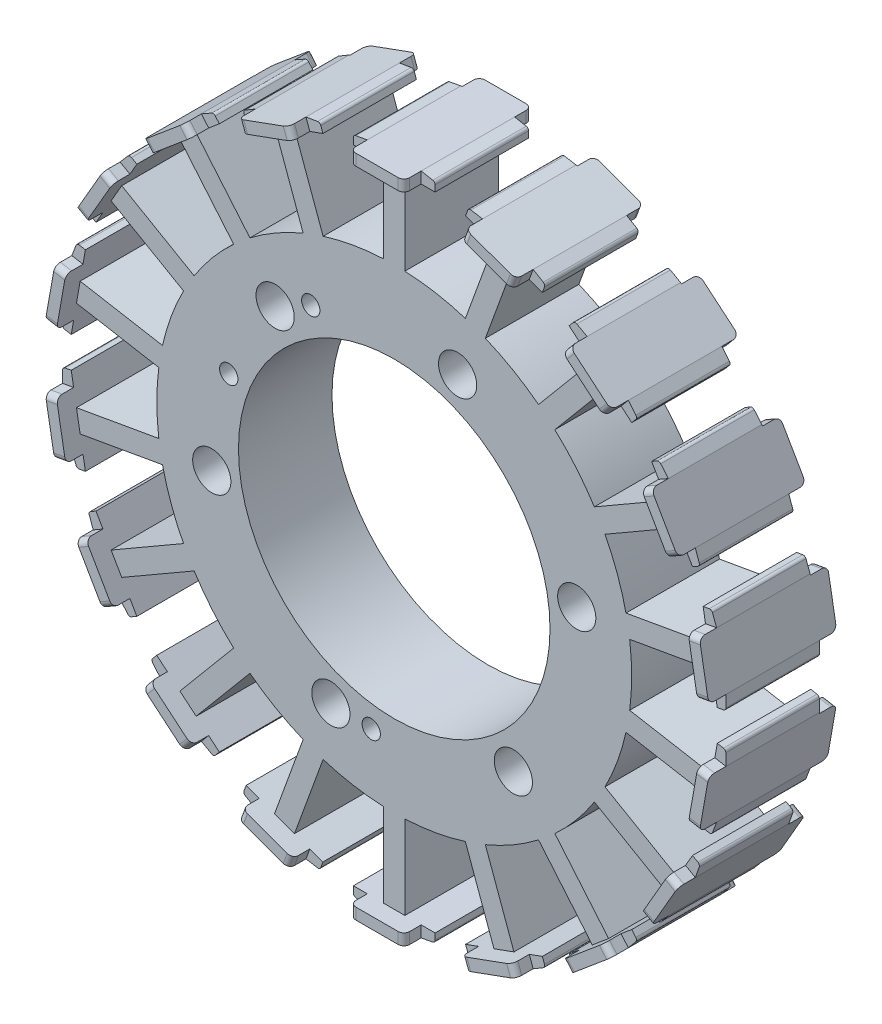
from build123d import *

# Parameters (mm, degrees)
SKETCH1_R           = 26.9
BOSS_EXTRUDE1_DEPTH = 16.148
SKETCH3_R           = 3.3
CUT_EXTRUDE1_DEPTH  = 17
SKETCH4_W           = 9.09525
SKETCH4_H           = 1.948
BOSS_EXTRUDE3_DEPTH = 2.976
SKETCH5_W           = 9.3
SKETCH5_H           = 1.948
BOSS_EXTRUDE4_DEPTH = 2.976
FILLET6_R           = 1
FILLET7_R           = 1
FILLET8_R           = 1
FILLET9_R           = 1
SKETCH6_R           = 1.58
CUT_EXTRUDE2_DEPTH  = 84.283946065
SKETCH7_R           = 1.58
CUT_EXTRUDE3_DEPTH  = 84.283946065
FILLET10_R          = 0.5
CIRPATTERN1_DEPTH   = 16.148
FILLET11_R          = 0.5
CIRPATTERN2_DEPTH   = 16.148


# Read off the part's stored shape, not the designer's step: CirPattern1, CirPattern2
with BuildPart() as part:
    # Sketch1 → Boss-Extrude1 (new body)
    # profile 1 of 19: a face of its own
    with BuildSketch(Plane.XY):
        with BuildLine():
            ThreePointArc((15.73264799, 37.861375929), (14.022825876, 38.527397452), (12.284915764, 39.116247835))
            ThreePointArc((12.284915764, 39.116247835), (7.119575284, 40.377117873), (1.8345, 40.958938094))
            ThreePointArc((1.8345, 40.958938094), (1.237294731, 40.981326257), (0.639826578, 40.995007281))
            Line((0.639826578, 40.995007281), (0.638750622, 40.99502406))
            ThreePointArc((0.638750622, 40.99502406), (-0.598146882, 40.995636601), (-1.8345, 40.958938094))
            ThreePointArc((-1.8345, 40.958938094), (-7.119575284, 40.377117874), (-12.284915764, 39.116247835))
            ThreePointArc((-12.284915764, 39.116247835), (-14.022825876, 38.527397452), (-15.73264799, 37.861375929))
            ThreePointArc((-15.73264799, 37.861375929), (-20.5, 35.507041555), (-24.922589381, 32.555560793))
            ThreePointArc((-24.922589381, 32.555560793), (-26.354291997, 31.407822168), (-27.733206443, 30.197173053))
            ThreePointArc((-27.733206443, 30.197173053), (-31.407822168, 26.354291997), (-34.554230901, 22.06819265))
            ThreePointArc((-34.554230901, 22.06819265), (-35.507041555, 20.5), (-36.388730901, 18.890745444))
            ThreePointArc((-36.388730901, 18.890745444), (-38.527397452, 14.022825876), (-40.018122208, 8.919074782))
            ThreePointArc((-40.018122208, 8.919074782), (-40.377117873, 7.119575284), (-40.655237372, 5.305815136))
            ThreePointArc((-40.655237372, 5.305815136), (-41, 0), (-40.655237372, -5.305815136))
            ThreePointArc((-40.655237372, -5.305815136), (-40.377117874, -7.119575284), (-40.018122208, -8.919074782))
            ThreePointArc((-40.018122208, -8.919074782), (-38.527397452, -14.022825876), (-36.388730901, -18.890745443))
            ThreePointArc((-36.388730901, -18.890745443), (-35.507041555, -20.5), (-34.554230901, -22.06819265))
            ThreePointArc((-34.554230901, -22.06819265), (-31.407822168, -26.354291997), (-27.733206443, -30.197173053))
            ThreePointArc((-27.733206443, -30.197173053), (-26.354291997, -31.407822168), (-24.922589382, -32.555560793))
            ThreePointArc((-24.922589382, -32.555560793), (-20.5, -35.507041555), (-15.73264799, -37.861375929))
            ThreePointArc((-15.73264799, -37.861375929), (-14.022825876, -38.527397452), (-12.284915764, -39.116247835))
            ThreePointArc((-12.284915764, -39.116247835), (-7.119575284, -40.377117873), (-1.8345, -40.958938094))
            ThreePointArc((-1.8345, -40.958938094), (0, -41), (1.8345, -40.958938094))
            ThreePointArc((1.8345, -40.958938094), (7.119575284, -40.377117874), (12.284915764, -39.116247835))
            ThreePointArc((12.284915764, -39.116247835), (14.022825876, -38.527397452), (15.73264799, -37.861375929))
            ThreePointArc((15.73264799, -37.861375929), (20.5, -35.507041555), (24.922589381, -32.555560793))
            ThreePointArc((24.922589381, -32.555560793), (26.354291997, -31.407822168), (27.733206443, -30.197173053))
            ThreePointArc((27.733206443, -30.197173053), (31.407822168, -26.354291997), (34.554230901, -22.06819265))
            ThreePointArc((34.554230901, -22.06819265), (35.507041555, -20.5), (36.388730901, -18.890745444))
            ThreePointArc((36.388730901, -18.890745444), (38.527397452, -14.022825876), (40.018122208, -8.919074782))
            ThreePointArc((40.018122208, -8.919074782), (40.377117873, -7.119575284), (40.655237372, -5.305815136))
            ThreePointArc((40.655237372, -5.305815136), (40.913718556, -2.658502188), (41, 0))
            ThreePointArc((41, 0), (40.913718556, 2.658502188), (40.655237372, 5.305815136))
            ThreePointArc((40.655237372, 5.305815136), (40.377117874, 7.119575284), (40.018122208, 8.919074782))
            ThreePointArc((40.018122208, 8.919074782), (38.527397452, 14.022825876), (36.388730901, 18.890745443))
            ThreePointArc((36.388730901, 18.890745443), (35.507041555, 20.5), (34.554230901, 22.06819265))
            ThreePointArc((34.554230901, 22.06819265), (31.407822168, 26.354291997), (27.733206443, 30.197173053))
            ThreePointArc((27.733206443, 30.197173053), (26.354291997, 31.407822168), (24.922589382, 32.555560793))
            ThreePointArc((24.922589382, 32.555560793), (20.5, 35.507041555), (15.73264799, 37.861375929))
        make_face()
        Circle(SKETCH1_R, mode=Mode.SUBTRACT)
    # profile 2 of 19: a face of its own
    with BuildSketch(Plane.XY):
        with BuildLine():
            Line((12.317765655, 54.473146842), (17.224370674, 52.687288664))
            Line((17.224370674, 52.687288664), (12.284915764, 39.116247835))
            ThreePointArc((12.284915764, 39.116247835), (14.022825876, 38.527397452), (15.73264799, 37.861375929))
            Line((15.73264799, 37.861375929), (20.6721029, 51.432416758))
            Line((20.6721029, 51.432416758), (25.578707919, 49.64655858))
            Line((25.578707919, 49.64655858), (26.091738134, 51.056097511))
            Line((26.091738134, 51.056097511), (23.984062713, 52.29998027))
            Line((23.984062713, 52.29998027), (15.24492134, 55.480767603))
            Line((15.24492134, 55.480767603), (12.83079587, 55.882685774))
            Line((12.83079587, 55.882685774), (12.317765655, 54.473146842))
        make_face()
    # profile 3 of 19: a face of its own
    with BuildSketch(Plane.XY):
        with BuildLine():
            ThreePointArc((0.639826578, 40.995007281), (1.237294731, 40.981326257), (1.8345, 40.958938094))
            Line((1.8345, 40.958938094), (1.8345, 55.400938094))
            Line((1.8345, 55.400938094), (7.056, 55.400938094))
            Line((7.056, 55.400938094), (7.056, 56.900938094))
            Line((7.056, 56.900938094), (4.65, 57.348938094))
            Line((4.65, 57.348938094), (-4.65, 57.348938094))
            Line((-4.65, 57.348938094), (-7.056, 56.900938094))
            Line((-7.056, 56.900938094), (-7.056, 55.400938094))
            Line((-7.056, 55.400938094), (-1.8345, 55.400938094))
            Line((-1.8345, 55.400938094), (-1.8345, 40.958938094))
            ThreePointArc((-1.8345, 40.958938094), (-0.598146882, 40.995636601), (0.638750622, 40.99502406))
            Line((0.638750622, 40.99502406), (0.639826578, 40.995007281))
        make_face()
    # profile 4 of 19: a face of its own
    with BuildSketch(Plane.XY):
        with BuildLine():
            ThreePointArc((-15.73264799, 37.861375929), (-14.022825876, 38.527397452), (-12.284915764, 39.116247835))
            Line((-12.284915764, 39.116247835), (-17.224370674, 52.687288664))
            Line((-17.224370674, 52.687288664), (-12.317765655, 54.473146842))
            Line((-12.317765655, 54.473146842), (-12.83079587, 55.882685774))
            Line((-12.83079587, 55.882685774), (-15.24492134, 55.480767603))
            Line((-15.24492134, 55.480767603), (-23.984062713, 52.29998027))
            Line((-23.984062713, 52.29998027), (-26.091738134, 51.056097511))
            Line((-26.091738134, 51.056097511), (-25.578707919, 49.64655858))
            Line((-25.578707919, 49.64655858), (-20.6721029, 51.432416758))
            Line((-20.6721029, 51.432416758), (-15.73264799, 37.861375929))
        make_face()
    # profile 5 of 19: a face of its own
    with BuildSketch(Plane.XY):
        with BuildLine():
            ThreePointArc((-27.733206443, 30.197173053), (-26.354291997, 31.407822168), (-24.922589381, 32.555560793))
            Line((-24.922589381, 32.555560793), (-34.205728041, 43.61877464))
            Line((-34.205728041, 43.61877464), (-30.205826981, 46.975090144))
            Line((-30.205826981, 46.975090144), (-31.170008395, 48.124156809))
            Line((-31.170008395, 48.124156809), (-33.301080175, 46.92079773))
            Line((-33.301080175, 46.92079773), (-40.425293496, 40.94287296))
            Line((-40.425293496, 40.94287296), (-41.980427577, 39.053138061))
            Line((-41.980427577, 39.053138061), (-41.016246162, 37.904071396))
            Line((-41.016246162, 37.904071396), (-37.016345102, 41.2603869))
            Line((-37.016345102, 41.2603869), (-27.733206443, 30.197173053))
        make_face()
    # profile 6 of 19: a face of its own
    with BuildSketch(Plane.XY):
        with BuildLine():
            ThreePointArc((-36.388730901, 18.890745444), (-35.507041555, 20.5), (-34.554230901, 22.06819265))
            Line((-34.554230901, 22.06819265), (-47.061369782, 29.28919265))
            Line((-47.061369782, 29.28919265), (-44.450619782, 33.811144296))
            Line((-44.450619782, 33.811144296), (-45.749657888, 34.561144296))
            Line((-45.749657888, 34.561144296), (-47.340637269, 32.701487174))
            Line((-47.340637269, 32.701487174), (-51.990637269, 24.647450919))
            Line((-51.990637269, 24.647450919), (-52.805657888, 22.339793798))
            Line((-52.805657888, 22.339793798), (-51.506619782, 21.589793798))
            Line((-51.506619782, 21.589793798), (-48.895869782, 26.111745444))
            Line((-48.895869782, 26.111745444), (-36.388730901, 18.890745444))
        make_face()
    # profile 7 of 19: a face of its own
    with BuildSketch(Plane.XY):
        with BuildLine():
            ThreePointArc((-40.655237372, 5.305815136), (-40.377117873, 7.119575284), (-40.018122208, 8.919074782))
            Line((-40.018122208, 8.919074782), (-54.240715777, 11.426901764))
            Line((-54.240715777, 11.426901764), (-53.334011817, 16.569075446))
            Line((-53.334011817, 16.569075446), (-54.811223447, 16.829547713))
            Line((-54.811223447, 16.829547713), (-55.670214835, 14.537894643))
            Line((-55.670214835, 14.537894643), (-57.285142888, 5.37918254))
            Line((-57.285142888, 5.37918254), (-57.26174653, 2.931940702))
            Line((-57.26174653, 2.931940702), (-55.7845349, 2.671468436))
            Line((-55.7845349, 2.671468436), (-54.877830941, 7.813642118))
            Line((-54.877830941, 7.813642118), (-40.655237372, 5.305815136))
        make_face()
    # profile 8 of 19: a face of its own
    with BuildSketch(Plane.XY):
        with BuildLine():
            ThreePointArc((-40.018122208, -8.919074782), (-40.377117874, -7.119575284), (-40.655237372, -5.305815136))
            Line((-40.655237372, -5.305815136), (-54.877830941, -7.813642118))
            Line((-54.877830941, -7.813642118), (-55.7845349, -2.671468436))
            Line((-55.7845349, -2.671468436), (-57.26174653, -2.931940702))
            Line((-57.26174653, -2.931940702), (-57.285142888, -5.37918254))
            Line((-57.285142888, -5.37918254), (-55.670214835, -14.537894643))
            Line((-55.670214835, -14.537894643), (-54.811223447, -16.829547713))
            Line((-54.811223447, -16.829547713), (-53.334011817, -16.569075446))
            Line((-53.334011817, -16.569075446), (-54.240715777, -11.426901764))
            Line((-54.240715777, -11.426901764), (-40.018122208, -8.919074782))
        make_face()
    # profile 9 of 19: a face of its own
    with BuildSketch(Plane.XY):
        with BuildLine():
            ThreePointArc((-34.554230901, -22.06819265), (-35.507041555, -20.5), (-36.388730901, -18.890745443))
            Line((-36.388730901, -18.890745443), (-48.895869783, -26.111745443))
            Line((-48.895869783, -26.111745443), (-51.506619782, -21.589793798))
            Line((-51.506619782, -21.589793798), (-52.805657888, -22.339793798))
            Line((-52.805657888, -22.339793798), (-51.990637269, -24.647450919))
            Line((-51.990637269, -24.647450919), (-47.340637269, -32.701487174))
            Line((-47.340637269, -32.701487174), (-45.749657888, -34.561144296))
            Line((-45.749657888, -34.561144296), (-44.450619782, -33.811144296))
            Line((-44.450619782, -33.811144296), (-47.061369782, -29.28919265))
            Line((-47.061369782, -29.28919265), (-34.554230901, -22.06819265))
        make_face()
    # profile 10 of 19: a face of its own
    with BuildSketch(Plane.XY):
        with BuildLine():
            ThreePointArc((-24.922589382, -32.555560793), (-26.354291997, -31.407822168), (-27.733206443, -30.197173053))
            Line((-27.733206443, -30.197173053), (-37.016345103, -41.2603869))
            Line((-37.016345103, -41.2603869), (-41.016246162, -37.904071396))
            Line((-41.016246162, -37.904071396), (-41.980427577, -39.053138061))
            Line((-41.980427577, -39.053138061), (-40.425293496, -40.94287296))
            Line((-40.425293496, -40.94287296), (-33.301080175, -46.92079773))
            Line((-33.301080175, -46.92079773), (-31.170008395, -48.124156809))
            Line((-31.170008395, -48.124156809), (-30.205826981, -46.975090144))
            Line((-30.205826981, -46.975090144), (-34.205728041, -43.61877464))
            Line((-34.205728041, -43.61877464), (-24.922589382, -32.555560793))
        make_face()
    # profile 11 of 19: a face of its own
    with BuildSketch(Plane.XY):
        with BuildLine():
            Line((34.205728041, 43.61877464), (24.922589382, 32.555560793))
            ThreePointArc((24.922589382, 32.555560793), (26.354291997, 31.407822168), (27.733206443, 30.197173053))
            Line((27.733206443, 30.197173053), (37.016345103, 41.2603869))
            Line((37.016345103, 41.2603869), (41.016246162, 37.904071396))
            Line((41.016246162, 37.904071396), (41.980427577, 39.053138061))
            Line((41.980427577, 39.053138061), (40.425293496, 40.94287296))
            Line((40.425293496, 40.94287296), (33.301080175, 46.92079773))
            Line((33.301080175, 46.92079773), (31.170008395, 48.124156809))
            Line((31.170008395, 48.124156809), (30.205826981, 46.975090144))
            Line((30.205826981, 46.975090144), (34.205728041, 43.61877464))
        make_face()
    # profile 12 of 19: a face of its own
    with BuildSketch(Plane.XY):
        with BuildLine():
            Line((47.061369783, 29.28919265), (34.554230901, 22.06819265))
            ThreePointArc((34.554230901, 22.06819265), (35.507041555, 20.5), (36.388730901, 18.890745443))
            Line((36.388730901, 18.890745443), (48.895869783, 26.111745443))
            Line((48.895869783, 26.111745443), (51.506619783, 21.589793798))
            Line((51.506619783, 21.589793798), (52.805657888, 22.339793798))
            Line((52.805657888, 22.339793798), (51.990637269, 24.647450919))
            Line((51.990637269, 24.647450919), (47.340637269, 32.701487174))
            Line((47.340637269, 32.701487174), (45.749657888, 34.561144296))
            Line((45.749657888, 34.561144296), (44.450619783, 33.811144296))
            Line((44.450619783, 33.811144296), (47.061369783, 29.28919265))
        make_face()
    # profile 13 of 19: a face of its own
    with BuildSketch(Plane.XY):
        with BuildLine():
            Line((54.240715777, 11.426901764), (40.018122208, 8.919074782))
            ThreePointArc((40.018122208, 8.919074782), (40.377117874, 7.119575284), (40.655237372, 5.305815136))
            Line((40.655237372, 5.305815136), (54.877830941, 7.813642118))
            Line((54.877830941, 7.813642118), (55.7845349, 2.671468436))
            Line((55.7845349, 2.671468436), (57.26174653, 2.931940702))
            Line((57.26174653, 2.931940702), (57.285142888, 5.37918254))
            Line((57.285142888, 5.37918254), (55.670214835, 14.537894643))
            Line((55.670214835, 14.537894643), (54.811223447, 16.829547713))
            Line((54.811223447, 16.829547713), (53.334011817, 16.569075446))
            Line((53.334011817, 16.569075446), (54.240715777, 11.426901764))
        make_face()
    # profile 14 of 19: a face of its own
    with BuildSketch(Plane.XY):
        with BuildLine():
            Line((54.877830941, -7.813642118), (40.655237372, -5.305815136))
            ThreePointArc((40.655237372, -5.305815136), (40.377117873, -7.119575284), (40.018122208, -8.919074782))
            Line((40.018122208, -8.919074782), (54.240715777, -11.426901764))
            Line((54.240715777, -11.426901764), (53.334011817, -16.569075446))
            Line((53.334011817, -16.569075446), (54.811223447, -16.829547713))
            Line((54.811223447, -16.829547713), (55.670214835, -14.537894643))
            Line((55.670214835, -14.537894643), (57.285142888, -5.37918254))
            Line((57.285142888, -5.37918254), (57.26174653, -2.931940702))
            Line((57.26174653, -2.931940702), (55.7845349, -2.671468436))
            Line((55.7845349, -2.671468436), (54.877830941, -7.813642118))
        make_face()
    # profile 15 of 19: a face of its own
    with BuildSketch(Plane.XY):
        with BuildLine():
            Line((48.895869783, -26.111745444), (36.388730901, -18.890745444))
            ThreePointArc((36.388730901, -18.890745444), (35.507041555, -20.5), (34.554230901, -22.06819265))
            Line((34.554230901, -22.06819265), (47.061369782, -29.28919265))
            Line((47.061369782, -29.28919265), (44.450619782, -33.811144296))
            Line((44.450619782, -33.811144296), (45.749657888, -34.561144296))
            Line((45.749657888, -34.561144296), (47.340637269, -32.701487174))
            Line((47.340637269, -32.701487174), (51.990637269, -24.647450919))
            Line((51.990637269, -24.647450919), (52.805657888, -22.339793798))
            Line((52.805657888, -22.339793798), (51.506619783, -21.589793798))
            Line((51.506619783, -21.589793798), (48.895869783, -26.111745444))
        make_face()
    # profile 16 of 19: a face of its own
    with BuildSketch(Plane.XY):
        with BuildLine():
            Line((37.016345102, -41.2603869), (27.733206443, -30.197173053))
            ThreePointArc((27.733206443, -30.197173053), (26.354291997, -31.407822168), (24.922589381, -32.555560793))
            Line((24.922589381, -32.555560793), (34.205728041, -43.61877464))
            Line((34.205728041, -43.61877464), (30.205826981, -46.975090144))
            Line((30.205826981, -46.975090144), (31.170008395, -48.124156809))
            Line((31.170008395, -48.124156809), (33.301080175, -46.92079773))
            Line((33.301080175, -46.92079773), (40.425293496, -40.94287296))
            Line((40.425293496, -40.94287296), (41.980427577, -39.053138061))
            Line((41.980427577, -39.053138061), (41.016246162, -37.904071396))
            Line((41.016246162, -37.904071396), (37.016345102, -41.2603869))
        make_face()
    # profile 17 of 19: a face of its own
    with BuildSketch(Plane.XY):
        with BuildLine():
            Line((20.6721029, -51.432416758), (15.73264799, -37.861375929))
            ThreePointArc((15.73264799, -37.861375929), (14.022825876, -38.527397452), (12.284915764, -39.116247835))
            Line((12.284915764, -39.116247835), (17.224370674, -52.687288664))
            Line((17.224370674, -52.687288664), (12.317765655, -54.473146842))
            Line((12.317765655, -54.473146842), (12.83079587, -55.882685774))
            Line((12.83079587, -55.882685774), (15.24492134, -55.480767603))
            Line((15.24492134, -55.480767603), (23.984062713, -52.29998027))
            Line((23.984062713, -52.29998027), (26.091738134, -51.056097511))
            Line((26.091738134, -51.056097511), (25.578707919, -49.64655858))
            Line((25.578707919, -49.64655858), (20.6721029, -51.432416758))
        make_face()
    # profile 18 of 19: a face of its own
    with BuildSketch(Plane.XY):
        with BuildLine():
            Line((1.8345, -55.400938094), (1.8345, -40.958938094))
            ThreePointArc((1.8345, -40.958938094), (0, -41), (-1.8345, -40.958938094))
            Line((-1.8345, -40.958938094), (-1.8345, -55.400938094))
            Line((-1.8345, -55.400938094), (-7.056, -55.400938094))
            Line((-7.056, -55.400938094), (-7.056, -56.900938094))
            Line((-7.056, -56.900938094), (-4.65, -57.348938094))
            Line((-4.65, -57.348938094), (4.65, -57.348938094))
            Line((4.65, -57.348938094), (7.056, -56.900938094))
            Line((7.056, -56.900938094), (7.056, -55.400938094))
            Line((7.056, -55.400938094), (1.8345, -55.400938094))
        make_face()
    # profile 19 of 19: a face of its own
    with BuildSketch(Plane.XY):
        with BuildLine():
            Line((-17.224370674, -52.687288664), (-12.284915764, -39.116247835))
            ThreePointArc((-12.284915764, -39.116247835), (-14.022825876, -38.527397452), (-15.73264799, -37.861375929))
            Line((-15.73264799, -37.861375929), (-20.6721029, -51.432416758))
            Line((-20.6721029, -51.432416758), (-25.578707919, -49.64655858))
            Line((-25.578707919, -49.64655858), (-26.091738134, -51.056097511))
            Line((-26.091738134, -51.056097511), (-23.984062713, -52.29998027))
            Line((-23.984062713, -52.29998027), (-15.24492134, -55.480767603))
            Line((-15.24492134, -55.480767603), (-12.83079587, -55.882685774))
            Line((-12.83079587, -55.882685774), (-12.317765655, -54.473146842))
            Line((-12.317765655, -54.473146842), (-17.224370674, -52.687288664))
        make_face()
    extrude(amount=BOSS_EXTRUDE1_DEPTH)

    # Sketch3 → Cut-Extrude1 (cut)
    with BuildSketch(Plane.XY.offset(16.148)):
        with Locations((-31.513848096, -5.556741685)):
            Circle(SKETCH3_R)
        with Locations((-20.56920351, 24.51342218)):
            Circle(SKETCH3_R)
        with Locations((10.944644586, 30.070163865)):
            Circle(SKETCH3_R)
        with Locations((31.513848096, 5.556741685)):
            Circle(SKETCH3_R)
        with Locations((20.56920351, -24.51342218)):
            Circle(SKETCH3_R)
        with Locations((-10.944644586, -30.070163865)):
            Circle(SKETCH3_R)
    extrude(amount=-CUT_EXTRUDE1_DEPTH, mode=Mode.SUBTRACT)

    # Sketch4 → Boss-Extrude3 (add)
    with BuildSketch(Plane(origin=(0, 0, 0), x_dir=(-1, 0, 0), z_dir=(0, 0, -1))):
        with Locations((0.102375, -56.374938094)):
            Rectangle(SKETCH4_W, SKETCH4_H)
        Polygon((-15.24492134, -55.480767603), (-14.5786661, -53.650246378), (-23.12540541, -50.539487669), (-23.791660649, -52.370008894), align=None)
        Polygon((-33.301080175, -46.92079773), (-32.048929911, -45.428543155), (-39.016295632, -39.582229148), (-40.268445896, -41.074483723), align=None)
        Polygon((-47.340637269, -32.701487174), (-45.653619782, -31.727487174), (-50.201244783, -23.850769621), (-51.888262269, -24.824769621), align=None)
        Polygon((-55.670214835, -14.537894643), (-53.751809333, -14.199627992), (-55.33118292, -5.242555277), (-57.249588423, -5.580821927), align=None)
        Polygon((-57.285142888, 5.37918254), (-55.366737385, 5.040915889), (-53.787363797, 13.997988605), (-55.7057693, 14.336255255), align=None)
        Polygon((-51.990637269, 24.647450919), (-50.303619783, 23.673450919), (-45.755994782, 31.550168473), (-47.443012269, 32.524168473), align=None)
        Polygon((-40.425293496, 40.94287296), (-39.173143232, 39.450618385), (-32.205777511, 45.296932392), (-33.457927774, 46.789186967), align=None)
        Polygon((-23.984062713, 52.29998027), (-23.317807474, 50.469459045), (-14.771068165, 53.580217753), (-15.437323404, 55.410738979), align=None)
        with Locations((-0.102375, 56.374938094)):
            Rectangle(SKETCH4_W, SKETCH4_H)
        Polygon((15.24492134, 55.480767603), (14.5786661, 53.650246378), (23.12540541, 50.539487669), (23.791660649, 52.370008894), align=None)
        Polygon((33.301080175, 46.92079773), (32.048929911, 45.428543155), (39.016295632, 39.582229148), (40.268445896, 41.074483723), align=None)
        Polygon((47.340637269, 32.701487174), (45.653619782, 31.727487174), (50.201244783, 23.850769621), (51.888262269, 24.824769621), align=None)
        Polygon((55.670214835, 14.537894643), (53.751809333, 14.199627992), (55.33118292, 5.242555277), (57.249588423, 5.580821927), align=None)
        Polygon((57.285142888, -5.37918254), (55.366737385, -5.040915889), (53.787363797, -13.997988605), (55.7057693, -14.336255255), align=None)
        Polygon((51.990637269, -24.647450919), (50.303619783, -23.673450919), (45.755994782, -31.550168473), (47.443012269, -32.524168473), align=None)
        Polygon((40.425293496, -40.94287296), (39.173143232, -39.450618385), (32.205777511, -45.296932392), (33.457927774, -46.789186967), align=None)
        Polygon((23.984062713, -52.29998027), (23.317807474, -50.469459045), (14.771068165, -53.580217753), (15.437323404, -55.410738979), align=None)
    extrude(amount=BOSS_EXTRUDE3_DEPTH)

    # Sketch5 → Boss-Extrude4 (add)
    with BuildSketch(Plane.XY.offset(16.148)):
        Polygon((15.24492134, 55.480767603), (14.5786661, 53.650246378), (23.317807474, 50.469459045), (23.984062713, 52.29998027), align=None)
        with Locations((0, 56.374938094)):
            Rectangle(SKETCH5_W, SKETCH5_H)
        Polygon((33.301080175, 46.92079773), (32.048929911, 45.428543155), (39.173143232, 39.450618385), (40.425293496, 40.94287296), align=None)
        Polygon((47.340637269, 32.701487174), (45.653619782, 31.727487174), (50.303619782, 23.673450919), (51.990637269, 24.647450919), align=None)
        Polygon((55.670214835, 14.537894643), (53.751809333, 14.199627992), (55.366737385, 5.040915889), (57.285142888, 5.37918254), align=None)
        Polygon((57.285142888, -5.37918254), (55.366737385, -5.040915889), (53.751809333, -14.199627992), (55.670214835, -14.537894643), align=None)
        Polygon((51.990637269, -24.647450919), (50.303619782, -23.673450919), (45.653619782, -31.727487174), (47.340637269, -32.701487174), align=None)
        Polygon((40.425293496, -40.94287296), (39.173143232, -39.450618385), (32.048929911, -45.428543155), (33.301080175, -46.92079773), align=None)
        Polygon((23.984062713, -52.29998027), (23.317807474, -50.469459045), (14.5786661, -53.650246378), (15.24492134, -55.480767603), align=None)
        with Locations((0, -56.374938094)):
            Rectangle(SKETCH5_W, SKETCH5_H)
        Polygon((-15.24492134, -55.480767603), (-14.5786661, -53.650246378), (-23.317807474, -50.469459045), (-23.984062713, -52.29998027), align=None)
        Polygon((-33.301080175, -46.92079773), (-32.048929911, -45.428543155), (-39.173143232, -39.450618385), (-40.425293496, -40.94287296), align=None)
        Polygon((-47.340637269, -32.701487174), (-45.653619782, -31.727487174), (-50.303619782, -23.673450919), (-51.990637269, -24.647450919), align=None)
        Polygon((-55.670214835, -14.537894643), (-53.751809333, -14.199627992), (-55.366737385, -5.040915889), (-57.285142888, -5.37918254), align=None)
        Polygon((-57.285142888, 5.37918254), (-55.366737385, 5.040915889), (-53.751809333, 14.199627992), (-55.670214835, 14.537894643), align=None)
        Polygon((-51.990637269, 24.647450919), (-50.303619782, 23.673450919), (-45.653619782, 31.727487174), (-47.340637269, 32.701487174), align=None)
        Polygon((-40.425293496, 40.94287296), (-39.173143232, 39.450618385), (-32.048929911, 45.428543155), (-33.301080175, 46.92079773), align=None)
        Polygon((-23.984062713, 52.29998027), (-23.317807474, 50.469459045), (-14.5786661, 53.650246378), (-15.24492134, 55.480767603), align=None)
    extrude(amount=BOSS_EXTRUDE4_DEPTH)

    # Fillet6
    fillet6_edges = [part.edges().sort_by_distance(p)[0] for p in [
        (54.711012084, 14.368761318, 19.124),
        (56.325940136, 5.210049215, 19.124),
        (56.325940136, -5.210049215, 19.124),
        (54.711012084, -14.368761318, 19.124),
        (51.147128526, -24.160450919, 19.124),
        (46.497128526, -32.214487174, 19.124),
        (39.799218364, -40.196745673, 19.124),
        (32.675005043, -46.174670443, 19.124),
        (23.650935093, -51.384719657, 19.124),
        (14.91179372, -54.56550699, 19.124),
    ]]
    fillet(fillet6_edges, radius=FILLET6_R)

    # Fillet7
    fillet7_edges = [part.edges().sort_by_distance(p)[0] for p in [
        (-51.147128526, 24.160450919, 19.124),
        (-46.497128526, 32.214487174, 19.124),
        (-39.799218364, 40.196745673, 19.124),
        (-32.675005043, 46.174670443, 19.124),
        (-23.650935093, 51.384719657, 19.124),
        (-14.91179372, 54.56550699, 19.124),
        (-4.65, 56.374938094, 19.124),
        (4.65, 56.374938094, 19.124),
        (14.91179372, 54.56550699, 19.124),
        (23.650935093, 51.384719657, 19.124),
        (32.675005043, 46.174670443, 19.124),
        (39.799218364, 40.196745673, 19.124),
        (46.497128526, 32.214487174, 19.124),
        (51.147128526, 24.160450919, 19.124),
    ]]
    fillet(fillet7_edges, radius=FILLET7_R)

    # Fillet8
    fillet8_edges = [part.edges().sort_by_distance(p)[0] for p in [
        (4.65, -56.374938094, 19.124),
        (-4.65, -56.374938094, 19.124),
        (-14.91179372, -54.56550699, 19.124),
        (-23.650935093, -51.384719657, 19.124),
        (-32.675005043, -46.174670443, 19.124),
        (-39.799218364, -40.196745673, 19.124),
        (-46.497128526, -32.214487174, 19.124),
        (-51.147128526, -24.160450919, 19.124),
        (-54.711012084, -14.368761318, 19.124),
        (-56.325940136, -5.210049215, 19.124),
        (-56.325940136, 5.210049215, 19.124),
        (-54.711012084, 14.368761318, 19.124),
    ]]
    fillet(fillet8_edges, radius=FILLET8_R)

    # Fillet9
    fillet9_edges = [part.edges().sort_by_distance(p)[0] for p in [
        (-4.65, -56.374938094, -2.976),
        (4.44525, -56.374938094, -2.976),
        (14.91179372, -54.56550699, -2.976),
        (23.458533029, -51.454748282, -2.976),
        (32.675005043, -46.174670443, -2.976),
        (39.642370764, -40.328356436, -2.976),
        (46.497128526, -32.214487174, -2.976),
        (51.044753526, -24.337769621, -2.976),
        (54.711012084, -14.368761318, -2.976),
        (56.290385672, -5.411688602, -2.976),
        (56.325940136, 5.210049215, -2.976),
        (54.746566548, 14.16712193, -2.976),
        (51.147128526, 24.160450919, -2.976),
        (46.599503526, 32.037168473, -2.976),
        (39.799218364, 40.196745673, -2.976),
        (32.831852643, 46.04305968, -2.976),
        (23.650935093, 51.384719657, -2.976),
        (15.104195784, 54.495478366, -2.976),
        (4.65, 56.374938094, -2.976),
        (-4.44525, 56.374938094, -2.976),
        (-14.91179372, 54.56550699, -2.976),
        (-23.458533029, 51.454748282, -2.976),
        (-32.675005043, 46.174670443, -2.976),
        (-39.642370764, 40.328356436, -2.976),
        (-46.497128526, 32.214487174, -2.976),
        (-51.044753526, 24.337769621, -2.976),
        (-54.711012084, 14.368761318, -2.976),
        (-56.290385672, 5.411688602, -2.976),
        (-56.325940136, -5.210049215, -2.976),
        (-54.746566548, -14.16712193, -2.976),
        (-51.147128526, -24.160450919, -2.976),
        (-46.599503526, -32.037168473, -2.976),
        (-39.799218364, -40.196745673, -2.976),
        (-32.831852643, -46.04305968, -2.976),
        (-23.650935093, -51.384719657, -2.976),
        (-15.104195784, -54.495478366, -2.976),
    ]]
    fillet(fillet9_edges, radius=FILLET9_R)

    # Sketch6 → Cut-Extrude2 (cut, through all)
    with BuildSketch(Plane(origin=(0, 0, 0), x_dir=(-1, 0, 0), z_dir=(0, 0, -1))):
        with Locations((28.571895198, 10.383004103)):
            Circle(SKETCH6_R)
    extrude(amount=-CUT_EXTRUDE2_DEPTH, mode=Mode.SUBTRACT)

    # Sketch7 → Cut-Extrude3 (cut, through all)
    with BuildSketch(Plane(origin=(0, 0, 0), x_dir=(-1, 0, 0), z_dir=(0, 0, -1))):
        with Locations((14.415465161, 27.729488258)):
            Circle(SKETCH7_R)
        with Locations((3.97328694, -30.417399476)):
            Circle(SKETCH7_R)
    extrude(amount=-CUT_EXTRUDE3_DEPTH, mode=Mode.SUBTRACT)

    # Fillet10
    fillet10_edges = [part.edges().sort_by_distance(p)[0] for p in [
        (-7.056, -56.900938094, 8.074),
    ]]
    fillet(fillet10_edges, radius=FILLET10_R)

    # CirPattern1 outline → CirPattern1 (cut)
    with BuildSketch(Plane.XY):
        with BuildLine():
            Line((12.83079587, -55.882685774), (13.240647918, -55.814451132))
            ThreePointArc((13.240647918, -55.814451132), (12.906468171, -55.75305249), (12.688688798, -55.492249803))
            Line((12.688688798, -55.492249803), (12.83079587, -55.882685774))
        make_face()
        with BuildLine():
            Line((7.056, 56.900938094), (6.647527433, 56.976996161))
            ThreePointArc((6.647527433, 56.976996161), (6.940554103, 56.805004104), (7.056, 56.485444812))
            Line((7.056, 56.485444812), (7.056, 56.900938094))
        make_face()
        with BuildLine():
            Line((26.091738134, 51.056097511), (25.733912869, 51.267274561))
            ThreePointArc((25.733912869, 51.267274561), (25.95044312, 51.005433871), (25.949631063, 50.66566154))
            Line((25.949631063, 50.66566154), (26.091738134, 51.056097511))
        make_face()
        with BuildLine():
            Line((41.980427577, 39.053138061), (41.71640862, 39.373963025))
            ThreePointArc((41.71640862, 39.373963025), (41.83032571, 39.053855553), (41.713353643, 38.734851741))
            Line((41.713353643, 38.734851741), (41.980427577, 39.053138061))
        make_face()
        with BuildLine():
            Line((52.805657888, 22.339793798), (52.667289823, 22.731570451))
            ThreePointArc((52.667289823, 22.731570451), (52.664853668, 22.391805883), (52.445830151, 22.132047157))
            Line((52.445830151, 22.132047157), (52.805657888, 22.339793798))
        make_face()
        with BuildLine():
            Line((57.26174653, 2.931940702), (57.265718587, 3.347414998))
            ThreePointArc((57.265718587, 3.347414998), (57.147223024, 3.028973954), (56.852565524, 2.859791051))
            Line((56.852565524, 2.859791051), (57.26174653, 2.931940702))
        make_face()
        with BuildLine():
            Line((54.811223447, -16.829547713), (54.957056538, -16.440488107))
            ThreePointArc((54.957056538, -16.440488107), (54.73679388, -16.699196936), (54.402042441, -16.757398062))
            Line((54.402042441, -16.757398062), (54.811223447, -16.829547713))
        make_face()
        with BuildLine():
            Line((45.749657888, -34.561144296), (46.01976239, -34.24542571))
            ThreePointArc((46.01976239, -34.24542571), (45.724299565, -34.413198222), (45.389830151, -34.353397655))
            Line((45.389830151, -34.353397655), (45.749657888, -34.561144296))
        make_face()
        with BuildLine():
            Line((31.170008395, -48.124156809), (31.531805719, -47.919859564))
            ThreePointArc((31.531805719, -47.919859564), (31.196779904, -47.976459918), (30.902934462, -47.805870489))
            Line((30.902934462, -47.805870489), (31.170008395, -48.124156809))
        make_face()
        with BuildLine():
            Line((-26.091738134, -51.056097511), (-25.733912869, -51.267274561))
            ThreePointArc((-25.733912869, -51.267274561), (-25.95044312, -51.005433871), (-25.949631063, -50.66566154))
            Line((-25.949631063, -50.66566154), (-26.091738134, -51.056097511))
        make_face()
        with BuildLine():
            Line((-41.980427577, -39.053138061), (-41.71640862, -39.373963025))
            ThreePointArc((-41.71640862, -39.373963025), (-41.83032571, -39.053855553), (-41.713353643, -38.734851741))
            Line((-41.713353643, -38.734851741), (-41.980427577, -39.053138061))
        make_face()
        with BuildLine():
            Line((-52.805657888, -22.339793798), (-52.667289823, -22.731570451))
            ThreePointArc((-52.667289823, -22.731570451), (-52.664853668, -22.391805883), (-52.445830151, -22.132047157))
            Line((-52.445830151, -22.132047157), (-52.805657888, -22.339793798))
        make_face()
        with BuildLine():
            Line((-57.26174653, -2.931940702), (-57.265718587, -3.347414998))
            ThreePointArc((-57.265718587, -3.347414998), (-57.147223024, -3.028973954), (-56.852565524, -2.859791051))
            Line((-56.852565524, -2.859791051), (-57.26174653, -2.931940702))
        make_face()
        with BuildLine():
            Line((-54.811223447, 16.829547713), (-54.957056538, 16.440488107))
            ThreePointArc((-54.957056538, 16.440488107), (-54.73679388, 16.699196936), (-54.402042441, 16.757398062))
            Line((-54.402042441, 16.757398062), (-54.811223447, 16.829547713))
        make_face()
        with BuildLine():
            Line((-45.749657888, 34.561144296), (-46.01976239, 34.24542571))
            ThreePointArc((-46.01976239, 34.24542571), (-45.724299565, 34.413198222), (-45.389830151, 34.353397655))
            Line((-45.389830151, 34.353397655), (-45.749657888, 34.561144296))
        make_face()
        with BuildLine():
            Line((-31.170008395, 48.124156809), (-31.531805719, 47.919859564))
            ThreePointArc((-31.531805719, 47.919859564), (-31.196779904, 47.976459918), (-30.902934462, 47.805870489))
            Line((-30.902934462, 47.805870489), (-31.170008395, 48.124156809))
        make_face()
        with BuildLine():
            Line((-12.83079587, 55.882685774), (-13.240647918, 55.814451132))
            ThreePointArc((-13.240647918, 55.814451132), (-12.906468171, 55.75305249), (-12.688688798, 55.492249803))
            Line((-12.688688798, 55.492249803), (-12.83079587, 55.882685774))
        make_face()
    extrude(amount=CIRPATTERN1_DEPTH, mode=Mode.SUBTRACT)

    # Fillet11
    fillet11_edges = [part.edges().sort_by_distance(p)[0] for p in [
        (-12.83079587, -55.882685774, 8.074),
    ]]
    fillet(fillet11_edges, radius=FILLET11_R)

    # CirPattern2 outline → CirPattern2 (cut)
    with BuildSketch(Plane.XY):
        with BuildLine():
            Line((-31.170008395, -48.124156809), (-30.902934462, -47.805870489))
            ThreePointArc((-30.902934462, -47.805870489), (-31.196779904, -47.976459918), (-31.531805719, -47.919859564))
            Line((-31.531805719, -47.919859564), (-31.170008395, -48.124156809))
        make_face()
        with BuildLine():
            Line((-7.056, 56.900938094), (-7.056, 56.485444812))
            ThreePointArc((-7.056, 56.485444812), (-6.940554103, 56.805004104), (-6.647527433, 56.976996161))
            Line((-6.647527433, 56.976996161), (-7.056, 56.900938094))
        make_face()
        with BuildLine():
            Line((12.83079587, 55.882685774), (12.688688798, 55.492249803))
            ThreePointArc((12.688688798, 55.492249803), (12.906468171, 55.75305249), (13.240647918, 55.814451132))
            Line((13.240647918, 55.814451132), (12.83079587, 55.882685774))
        make_face()
        with BuildLine():
            Line((31.170008395, 48.124156809), (30.902934462, 47.805870489))
            ThreePointArc((30.902934462, 47.805870489), (31.196779904, 47.976459918), (31.531805719, 47.919859564))
            Line((31.531805719, 47.919859564), (31.170008395, 48.124156809))
        make_face()
        with BuildLine():
            Line((45.749657888, 34.561144296), (45.389830151, 34.353397655))
            ThreePointArc((45.389830151, 34.353397655), (45.724299565, 34.413198222), (46.01976239, 34.24542571))
            Line((46.01976239, 34.24542571), (45.749657888, 34.561144296))
        make_face()
        with BuildLine():
            Line((54.811223447, 16.829547713), (54.402042441, 16.757398062))
            ThreePointArc((54.402042441, 16.757398062), (54.73679388, 16.699196936), (54.957056538, 16.440488107))
            Line((54.957056538, 16.440488107), (54.811223447, 16.829547713))
        make_face()
        with BuildLine():
            Line((57.26174653, -2.931940702), (56.852565524, -2.859791051))
            ThreePointArc((56.852565524, -2.859791051), (57.147223024, -3.028973954), (57.265718587, -3.347414998))
            Line((57.265718587, -3.347414998), (57.26174653, -2.931940702))
        make_face()
        with BuildLine():
            Line((52.805657888, -22.339793798), (52.445830151, -22.132047157))
            ThreePointArc((52.445830151, -22.132047157), (52.664853668, -22.391805883), (52.667289823, -22.731570451))
            Line((52.667289823, -22.731570451), (52.805657888, -22.339793798))
        make_face()
        with BuildLine():
            Line((41.980427577, -39.053138061), (41.713353643, -38.734851741))
            ThreePointArc((41.713353643, -38.734851741), (41.83032571, -39.053855553), (41.71640862, -39.373963025))
            Line((41.71640862, -39.373963025), (41.980427577, -39.053138061))
        make_face()
        with BuildLine():
            Line((26.091738134, -51.056097511), (25.949631063, -50.66566154))
            ThreePointArc((25.949631063, -50.66566154), (25.95044312, -51.005433871), (25.733912869, -51.267274561))
            Line((25.733912869, -51.267274561), (26.091738134, -51.056097511))
        make_face()
        with BuildLine():
            Line((7.056, -56.900938094), (7.056, -56.485444812))
            ThreePointArc((7.056, -56.485444812), (6.940554103, -56.805004104), (6.647527433, -56.976996161))
            Line((6.647527433, -56.976996161), (7.056, -56.900938094))
        make_face()
        with BuildLine():
            Line((-45.749657888, -34.561144296), (-45.389830151, -34.353397655))
            ThreePointArc((-45.389830151, -34.353397655), (-45.724299565, -34.413198222), (-46.01976239, -34.24542571))
            Line((-46.01976239, -34.24542571), (-45.749657888, -34.561144296))
        make_face()
        with BuildLine():
            Line((-54.811223447, -16.829547713), (-54.402042441, -16.757398062))
            ThreePointArc((-54.402042441, -16.757398062), (-54.73679388, -16.699196936), (-54.957056538, -16.440488107))
            Line((-54.957056538, -16.440488107), (-54.811223447, -16.829547713))
        make_face()
        with BuildLine():
            Line((-57.26174653, 2.931940702), (-56.852565524, 2.859791051))
            ThreePointArc((-56.852565524, 2.859791051), (-57.147223024, 3.028973954), (-57.265718587, 3.347414998))
            Line((-57.265718587, 3.347414998), (-57.26174653, 2.931940702))
        make_face()
        with BuildLine():
            Line((-52.805657888, 22.339793798), (-52.445830151, 22.132047157))
            ThreePointArc((-52.445830151, 22.132047157), (-52.664853668, 22.391805883), (-52.667289823, 22.731570451))
            Line((-52.667289823, 22.731570451), (-52.805657888, 22.339793798))
        make_face()
        with BuildLine():
            Line((-41.980427577, 39.053138061), (-41.713353643, 38.734851741))
            ThreePointArc((-41.713353643, 38.734851741), (-41.83032571, 39.053855553), (-41.71640862, 39.373963025))
            Line((-41.71640862, 39.373963025), (-41.980427577, 39.053138061))
        make_face()
        with BuildLine():
            Line((-26.091738134, 51.056097511), (-25.949631063, 50.66566154))
            ThreePointArc((-25.949631063, 50.66566154), (-25.95044312, 51.005433871), (-25.733912869, 51.267274561))
            Line((-25.733912869, 51.267274561), (-26.091738134, 51.056097511))
        make_face()
    extrude(amount=CIRPATTERN2_DEPTH, mode=Mode.SUBTRACT)


solid = part.part
